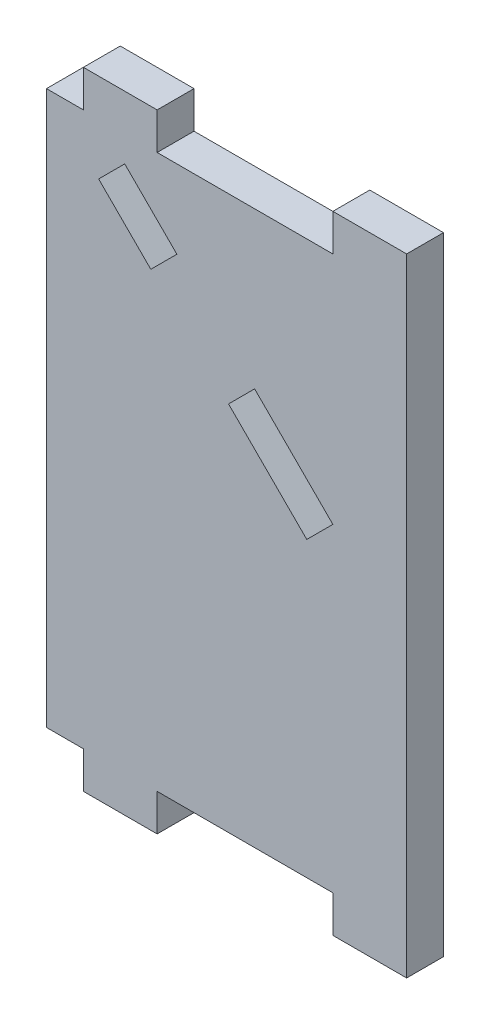
from build123d import *

# Parameters (mm, degrees)
BOSS_EXTRU_1_DEPTH = 5


with BuildPart() as part:
    # Esquisse1 → Boss.-Extru.1 (new body)
    with BuildSketch(Plane.XY):
        Polygon((-43.820162287, 75), (-48.820162287, 75), (-48.820162287, 0), (-43.820162287, 0), (-43.820162287, -5), (-33.820162287, -5), (-33.820162287, 0), (-10, 0), (-10, -5), (0, -5), (0, 80), (-10, 80), (-10, 75), (-33.820162287, 75), (-33.820162287, 80), (-43.820162287, 80), align=None)
        Polygon((-10, 43.250905525), (-13.535533906, 39.715371619), (-24.142135624, 50.321973337), (-20.606601718, 53.857507243), align=None, mode=Mode.SUBTRACT)
        Polygon((-31.142492757, 64.393398282), (-34.678026663, 60.857864376), (-41.749094475, 67.928932188), (-38.213560569, 71.464466094), align=None, mode=Mode.SUBTRACT)
    extrude(amount=BOSS_EXTRU_1_DEPTH)


solid = part.part
